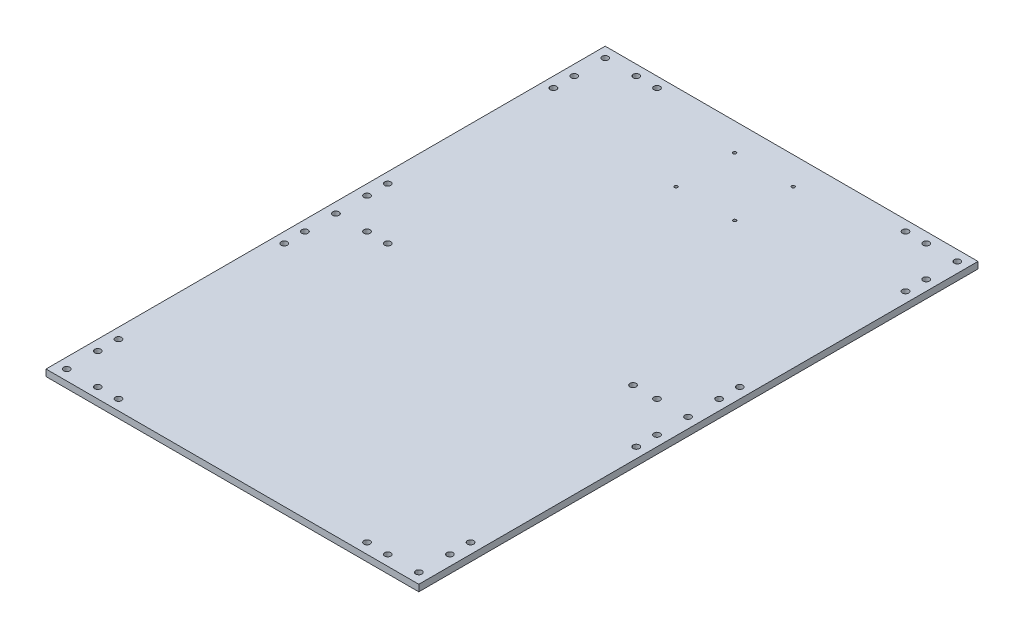
from build123d import *

# Parameters (mm, degrees)
SKETCH1_W             = 360
SKETCH1_H             = 540
BOSS_EXTRUDE1_DEPTH   = 6.35
F_3_0MM_DOWEL_HOLE1_D = 3
F_6_0MM_DOWEL_HOLE1_D = 6


with BuildPart() as part:
    # Sketch1 → Boss-Extrude1 (new body)
    with BuildSketch(Plane(origin=(0, 0, 0), x_dir=(1, 0, 0), z_dir=(0, 1, 0))):
        with Locations((180, -270)):
            Rectangle(SKETCH1_W, SKETCH1_H)
    extrude(amount=BOSS_EXTRUDE1_DEPTH)

    # Ø3.0mm Dowel Hole1 (through all)
    with Locations(Plane(origin=(0, 6.35, 0), x_dir=(1, 0, 0), z_dir=(0, 1, 0))):
        with Locations((151.715728753, -26.715728753), (208.284271247, -26.715728753), (208.284271247, -83.284271247), (151.715728753, -83.284271247)):
            Hole(F_3_0MM_DOWEL_HOLE1_D / 2)

    # Ø6.0mm Dowel Hole1 (through all)
    with Locations(Plane(origin=(0, 6.35, 0), x_dir=(1, 0, 0), z_dir=(0, 1, 0))):
        with Locations((10, -500), (40, -270), (10, -270), (10, -220), (40, -530), (10, -530), (320, -530), (350, -530), (350, -500), (10, -300), (350, -270), (10, -240), (320, -270), (350, -40), (350, -10), (320, -10), (40, -10), (10, -10), (10, -40), (60, -270), (10, -320), (10, -60), (60, -10), (300, -10), (350, -60), (350, -220), (350, -240), (296.924884631, -270), (350, -300), (350, -320), (350, -480), (300, -530), (10, -480), (60, -530)):
            Hole(F_6_0MM_DOWEL_HOLE1_D / 2)


solid = part.part
